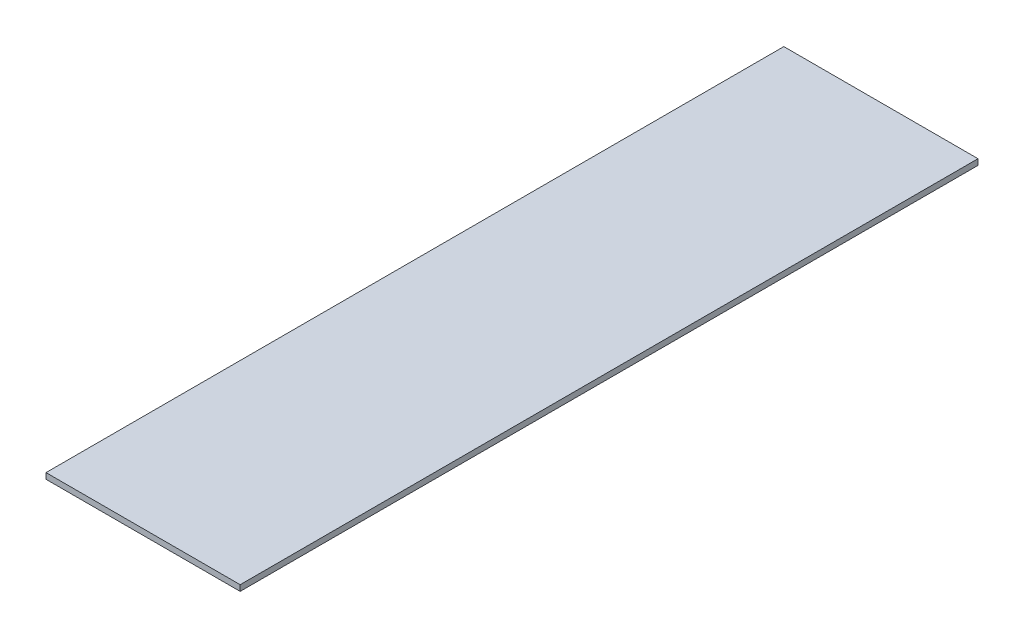
from build123d import *

# Parameters (mm, degrees)
SKETCH1_W           = 63.5
SKETCH1_H           = 241.3
BOSS_EXTRUDE1_DEPTH = 1.905


with BuildPart() as part:
    # Sketch1 → Boss-Extrude1 (new body)
    with BuildSketch(Plane(origin=(0, 0, 0), x_dir=(1, 0, 0), z_dir=(0, 1, 0))):
        with Locations((31.75, 120.65)):
            Rectangle(SKETCH1_W, SKETCH1_H)
    extrude(amount=BOSS_EXTRUDE1_DEPTH)


solid = part.part
